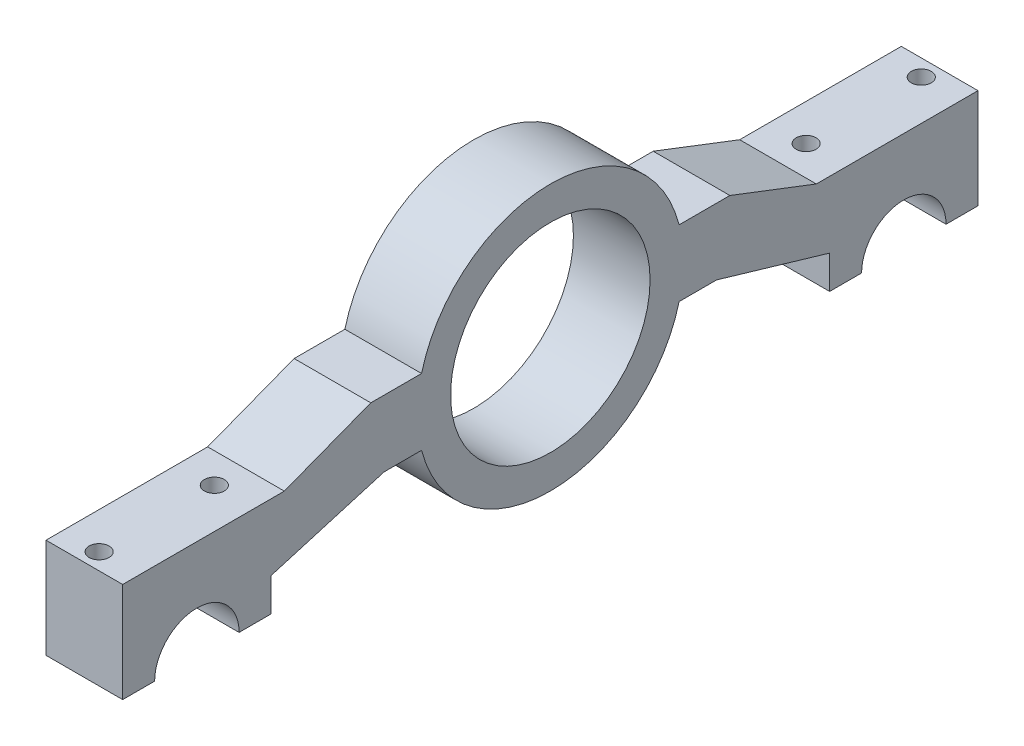
from build123d import *
from build123d.topology import SkipClean

# Parameters (mm, degrees)
SKETCH1_R            = 5.765
SKETCH1_R_2          = 4.765
BOSS_EXTRUDE1_DEPTH  = 10
SKETCH2_W            = 11.53
SKETCH2_H            = 10
BOSS_EXTRUDE2_DEPTH  = 10
SKETCH3_R            = 4.765
CUT_EXTRUDE1_DEPTH   = 10
BOSS_EXTRUDE5_DEPTH  = 10
SKETCH9_R            = 3.5
CUT_EXTRUDE4_DEPTH   = 26.158316716
SKETCH11_W           = 11.53
SKETCH11_H           = 10
BOSS_EXTRUDE6_DEPTH  = 48.155
SKETCH12_R           = 6.35
BOSS_EXTRUDE7_DEPTH  = 5.765
SKETCH13_W           = 10
SKETCH13_H           = 20
CUT_EXTRUDE5_DEPTH   = 11.53
CUT_EXTRUDE6_DEPTH   = 11.53
SKETCH15_W           = 10
SKETCH15_H           = 10
CUT_EXTRUDE7_DEPTH   = 11.53
SKETCH17_W           = 11.204655182
SKETCH17_H           = 10
BOSS_EXTRUDE10_DEPTH = 11.53
CUT_EXTRUDE9_DEPTH   = 74.053521476
SKETCH20_R           = 1.5
CUT_EXTRUDE10_DEPTH  = 73.36788877
CUT_EXTRUDE11_DEPTH  = 74.053521476
BOSS_EXTRUDE11_DEPTH = 11.53
SKETCH25_R           = 20
SKETCH25_R_2         = 15
BOSS_EXTRUDE12_DEPTH = 11.53
SKETCH26_R           = 15
CUT_EXTRUDE12_DEPTH  = 79.49724199


with BuildPart() as part:
    # Sketch1 → Boss-Extrude1 (new body)
    with BuildSketch(Plane.XY):
        Circle(SKETCH1_R)
        Circle(SKETCH1_R_2, mode=Mode.SUBTRACT)
    extrude(amount=BOSS_EXTRUDE1_DEPTH)

    # Sketch2 → Boss-Extrude2 (add)
    with BuildSketch(Plane(origin=(0, 0, 0), x_dir=(1, 0, 0), z_dir=(0, 1, 0))):
        with Locations((0, -5)):
            Rectangle(SKETCH2_W, SKETCH2_H)
    boss_extrude2 = extrude(amount=BOSS_EXTRUDE2_DEPTH)

    # Sketch3 → Cut-Extrude1 (cut)
    with SkipClean():  # the faces are left unmerged after this step: merging them gives an invalid solid
        with BuildSketch(Plane(origin=(0, 0, 0), x_dir=(-1, 0, 0), z_dir=(0, 0, -1))):
            Circle(SKETCH3_R)
        extrude(amount=-CUT_EXTRUDE1_DEPTH, mode=Mode.SUBTRACT)

    # Sketch8 → Boss-Extrude5 (add)
    with SkipClean():  # the faces are left unmerged after this step: merging them gives an invalid solid
        with BuildSketch(Plane(origin=(0, 10, 0), x_dir=(1, 0, 0), z_dir=(0, 1, 0))):
            Polygon((-5.765, 0), (-5.765, -10), (-2.765, -10), (2.765, -10), (5.765, -10), (5.765, 0), (2.765, 0), (-2.765, 0), align=None)
        boss_extrude5 = extrude(amount=BOSS_EXTRUDE5_DEPTH)

    # Sketch9 → Cut-Extrude4 (cut, through all)
    with SkipClean():  # the faces are left unmerged after this step: merging them gives an invalid solid
        with BuildSketch(Plane(origin=(5.765, 0, 0), x_dir=(0, 0, -1), z_dir=(1, 0, 0))):
            with Locations((-5, 15)):
                Circle(SKETCH9_R)
        cut_extrude4 = extrude(amount=-CUT_EXTRUDE4_DEPTH, mode=Mode.SUBTRACT)

    # Sketch11 → Boss-Extrude6 (add)
    with SkipClean():  # the faces are left unmerged after this step: merging them gives an invalid solid
        with BuildSketch(Plane(origin=(0, 0, 0), x_dir=(-1, 0, 0), z_dir=(0, 0, -1))):
            with Locations((0, 15)):
                Rectangle(SKETCH11_W, SKETCH11_H)
        boss_extrude6 = extrude(amount=BOSS_EXTRUDE6_DEPTH)

    # Sketch12 → Boss-Extrude7 (add, symmetric)
    with SkipClean():  # the faces are left unmerged after this step: merging them gives an invalid solid
        with BuildSketch(Plane(origin=(0, 0, 0), x_dir=(0, 0, -1), z_dir=(1, 0, 0))):
            with BuildLine():
                Line((59.31, 0), (59.31, 20))
                Line((59.31, 20), (47, 20))
                Line((47, 20), (37, 20))
                Line((37, 20), (37, 0))
                ThreePointArc((37, 0), (48.155, -11.155), (59.31, 0))
            make_face()
            with Locations((48.155, 0)):
                Circle(SKETCH12_R, mode=Mode.SUBTRACT)
        boss_extrude7 = extrude(amount=BOSS_EXTRUDE7_DEPTH, both=True)

    # Sketch13 → Cut-Extrude5 (cut)
    with BuildSketch(Plane.ZY.offset(5.765)):
        with Locations((5, 0)):
            Rectangle(SKETCH13_W, SKETCH13_H)
    extrude(amount=-CUT_EXTRUDE5_DEPTH, mode=Mode.SUBTRACT)

    # Sketch14 → Cut-Extrude6 (cut)
    with BuildSketch(Plane.ZY.offset(5.765)):
        Polygon((5, 18.5), (5, 10), (10, 10), (10, 18.5), (10, 20), (5, 20), align=None)
    cut_extrude6 = extrude(amount=-CUT_EXTRUDE6_DEPTH, mode=Mode.SUBTRACT)

    # Mirror1: Boss-Extrude2, Boss-Extrude5, Cut-Extrude4, Boss-Extrude6, Boss-Extrude7, Cut-Extrude6 across plane
    add(boss_extrude2.mirror(Plane(origin=(5.765, 18.5, 5), x_dir=(1, 0, 0), z_dir=(0, 0, -1))))
    add(boss_extrude5.mirror(Plane(origin=(5.765, 18.5, 5), x_dir=(1, 0, 0), z_dir=(0, 0, -1))))
    add(cut_extrude4.mirror(Plane(origin=(5.765, 18.5, 5), x_dir=(1, 0, 0), z_dir=(0, 0, -1))), mode=Mode.SUBTRACT)
    add(boss_extrude6.mirror(Plane(origin=(5.765, 18.5, 5), x_dir=(1, 0, 0), z_dir=(0, 0, -1))))
    add(boss_extrude7.mirror(Plane(origin=(5.765, 18.5, 5), x_dir=(1, 0, 0), z_dir=(0, 0, -1))))
    add(cut_extrude6.mirror(Plane(origin=(5.765, 18.5, 5), x_dir=(1, 0, 0), z_dir=(0, 0, -1))), mode=Mode.SUBTRACT)

    # Sketch15 → Cut-Extrude7 (cut)
    with BuildSketch(Plane.ZY.offset(5.765)):
        with Locations((5, 5)):
            Rectangle(SKETCH15_W, SKETCH15_H)
    extrude(amount=-CUT_EXTRUDE7_DEPTH, mode=Mode.SUBTRACT)

    # Sketch17 → Boss-Extrude10 (add)
    with BuildSketch(Plane.ZY.offset(5.765)):
        with Locations((1.267367683, 15)):
            Rectangle(SKETCH17_W, SKETCH17_H)
    extrude(amount=-BOSS_EXTRUDE10_DEPTH)

    # Sketch19 → Cut-Extrude9 (cut, through all)
    with BuildSketch(Plane.ZY.offset(5.765)):
        Polygon((-41.805, 0), (69.31, 0), (69.31, -15), (-59.31, -15), (-59.31, 0), align=None)
    extrude(amount=-CUT_EXTRUDE9_DEPTH, mode=Mode.SUBTRACT)

    # Sketch20 → Cut-Extrude10 (cut, through all)
    with BuildSketch(Plane(origin=(0, 0, 0), x_dir=(-1, 0, 0), z_dir=(0, -1, 0))):
        with Locations((0.265, 56.81)):
            Circle(SKETCH20_R)
        with Locations((0.265, 39.5)):
            Circle(SKETCH20_R)
        with Locations((0.265, -66.824084676)):
            Circle(SKETCH20_R)
        with Locations((0.265, -49.5)):
            Circle(SKETCH20_R)
    extrude(amount=-CUT_EXTRUDE10_DEPTH, mode=Mode.SUBTRACT)

    # Sketch22 → Cut-Extrude11 (cut, through all)
    with BuildSketch(Plane(origin=(5.765, 0, 0), x_dir=(0, 0, -1), z_dir=(1, 0, 0))):
        Polygon((22, 20), (35, 15), (59.31, 15), (59.31, 20), align=None)
        Polygon((-69.31, 20), (-69.31, 15), (-45, 15), (-32, 20), align=None)
    extrude(amount=-CUT_EXTRUDE11_DEPTH, mode=Mode.SUBTRACT)

    # Sketch23 → Boss-Extrude11 (add)
    with BuildSketch(Plane(origin=(5.765, 0, 0), x_dir=(0, 0, -1), z_dir=(1, 0, 0))):
        Polygon((-47, 10), (-47, 5), (-30, 10), align=None)
        Polygon((37, 10), (20, 10), (37, 5), align=None)
    extrude(amount=-BOSS_EXTRUDE11_DEPTH)

    # Sketch25 → Boss-Extrude12 (add)
    with BuildSketch(Plane(origin=(5.765, 0, 0), x_dir=(0, 0, -1), z_dir=(1, 0, 0))):
        with Locations((-5, 15)):
            Circle(SKETCH25_R)
        with Locations((-5, 15)):
            Circle(SKETCH25_R_2, mode=Mode.SUBTRACT)
    extrude(amount=-BOSS_EXTRUDE12_DEPTH)

    # Sketch26 → Cut-Extrude12 (cut, through all)
    with BuildSketch(Plane(origin=(5.765, 0, 0), x_dir=(0, 0, -1), z_dir=(1, 0, 0))):
        with Locations((-5, 15)):
            Circle(SKETCH26_R)
    extrude(amount=-CUT_EXTRUDE12_DEPTH, mode=Mode.SUBTRACT)


solid = part.part
